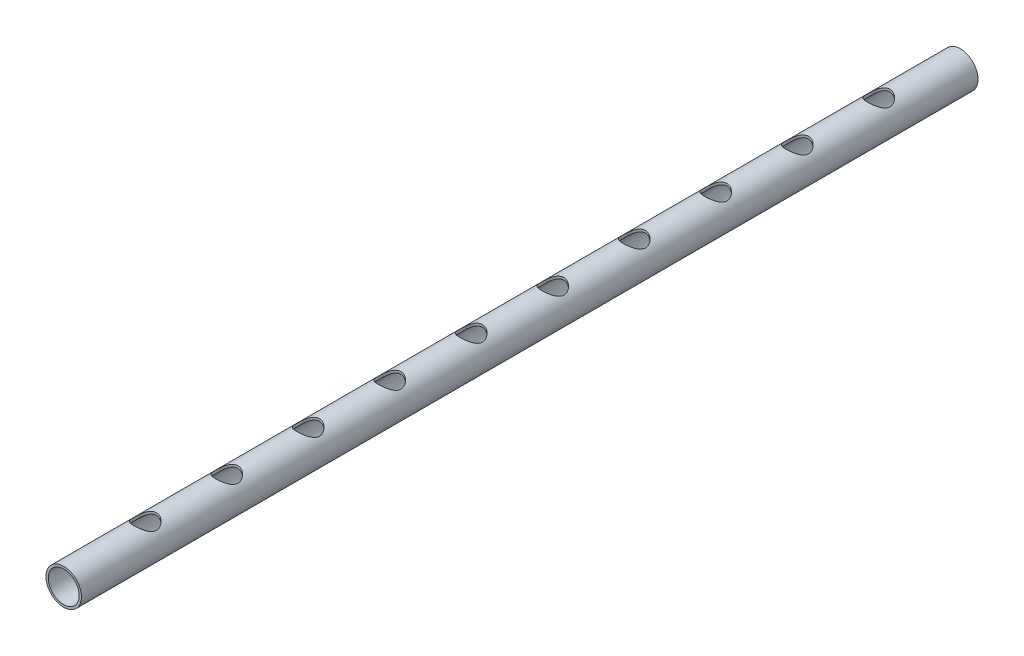
from build123d import *

# Parameters (mm, degrees)
SKETCH1_R               = 30.1625
SKETCH1_R_2             = 26.2509
BOSS_EXTRUDE1_DEPTH     = 1524
CUT_EXTRUDE1_DEPTH      = 1525.596849273
CUT_EXTRUDE1_DEPTH_BACK = 5.08
SKETCH3_R               = 19.05


with BuildPart() as part:
    # Sketch1 → Boss-Extrude1 (new body)
    with BuildSketch(Plane.XY):
        Circle(SKETCH1_R)
        Circle(SKETCH1_R_2, mode=Mode.SUBTRACT)
    extrude(amount=BOSS_EXTRUDE1_DEPTH)

    # Sketch3 → Cut-Extrude1 (cut, two sides: drawn at the far end of the back side and taken through both)
    with BuildSketch(Plane(origin=(0, 0, 0), x_dir=(1, 0, 0), z_dir=(0, 1, 0)).offset(-CUT_EXTRUDE1_DEPTH_BACK)):
        with Locations((0, -138.545454545)):
            Circle(SKETCH3_R)
        with Locations((0, -277.090909091)):
            Circle(SKETCH3_R)
        with Locations((0, -415.636363636)):
            Circle(SKETCH3_R)
        with Locations((0, -554.181818182)):
            Circle(SKETCH3_R)
        with Locations((0, -692.727272727)):
            Circle(SKETCH3_R)
        with Locations((0, -831.272727273)):
            Circle(SKETCH3_R)
        with Locations((0, -969.818181818)):
            Circle(SKETCH3_R)
        with Locations((0, -1108.363636364)):
            Circle(SKETCH3_R)
        with Locations((0, -1246.909090909)):
            Circle(SKETCH3_R)
        with Locations((0, -1385.454545455)):
            Circle(SKETCH3_R)
    extrude(amount=CUT_EXTRUDE1_DEPTH + CUT_EXTRUDE1_DEPTH_BACK, mode=Mode.SUBTRACT)


solid = part.part
